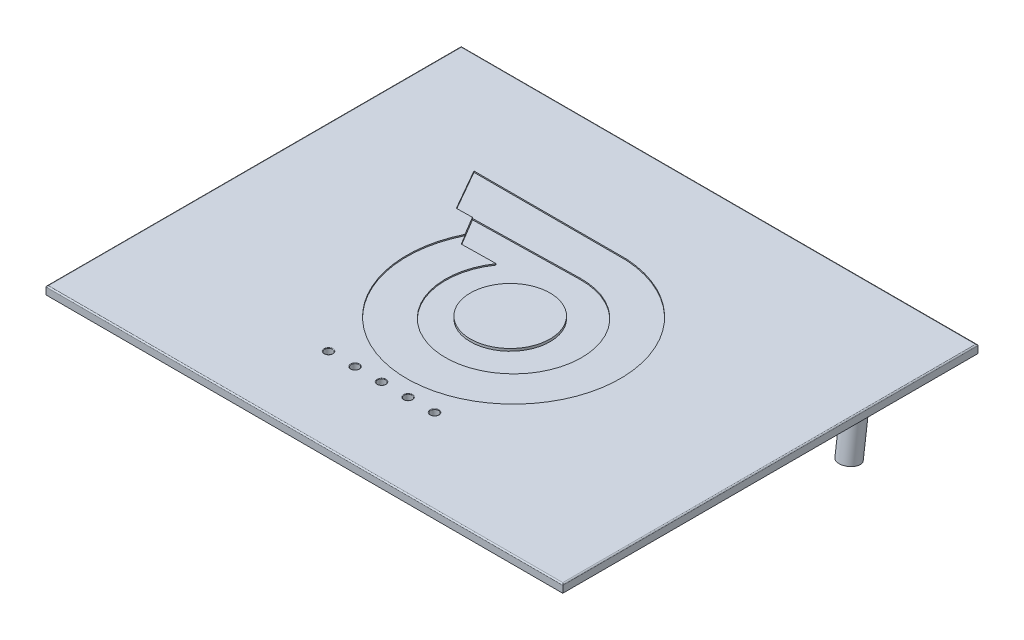
from build123d import *

# Parameters (mm, degrees)
SKETCH1_W                      = 128
SKETCH1_H                      = 101
BOSS_EXTRUDE1_DEPTH            = 2
SKETCH2_W                      = 1.2
SKETCH2_H                      = 98
BOSS_EXTRUDE2_DEPTH            = 1
SKETCH3_W                      = 128
SKETCH3_H                      = 2
BOSS_EXTRUDE3_DEPTH            = 0.48
SKETCH4_W                      = 128
SKETCH4_H                      = 2
BOSS_EXTRUDE4_DEPTH            = 1.37
BOSS_EXTRUDE5_START            = 2
SKETCH5_R                      = 2.5
BOSS_EXTRUDE5_DEPTH            = 13
M3_CLEARANCE_HOLE1_D           = 2.6
M3_CLEARANCE_HOLE1_DEPTH       = 10
M3_CLEARANCE_HOLE1_CSINK_D     = 3
M3_CLEARANCE_HOLE1_CSINK_ANGLE = 90
M3_CLEARANCE_HOLE1_TIP         = 0.781118805
M3_CLEARANCE_HOLE2_D           = 2.6
M3_CLEARANCE_HOLE2_DEPTH       = 10
M3_CLEARANCE_HOLE2_CSINK_D     = 3
M3_CLEARANCE_HOLE2_CSINK_ANGLE = 90
M3_CLEARANCE_HOLE2_TIP         = 0.781118805
SKETCH14_R                     = 1
CUT_EXTRUDE1_DEPTH             = 5
CUT_EXTRUDE2_DEPTH             = 0.4
CUT_EXTRUDE4_DEPTH             = 0.3
CUT_EXTRUDE5_DEPTH             = 0.6
SKETCH30_R                     = 9.871633986
BOSS_EXTRUDE13_DEPTH           = 0.6
FILLET1_R                      = 0.3
FILLET2_R                      = 0.12


with BuildPart() as part:
    # Sketch1 → Boss-Extrude1 (new body)
    with BuildSketch(Plane(origin=(0, 0, 0), x_dir=(1, 0, 0), z_dir=(0, 1, 0))):
        Rectangle(SKETCH1_W, SKETCH1_H)
    extrude(amount=BOSS_EXTRUDE1_DEPTH)

    # Sketch2 → Boss-Extrude2 (add)
    with BuildSketch(Plane.XZ):
        with Locations((62.3, 0)):
            Rectangle(SKETCH2_W, SKETCH2_H)
        with Locations((-62.3, 0)):
            Rectangle(SKETCH2_W, SKETCH2_H)
    extrude(amount=BOSS_EXTRUDE2_DEPTH)

    # Sketch3 → Boss-Extrude3 (add)
    with BuildSketch(Plane.XY.offset(50.5)):
        with Locations((0, 1)):
            Rectangle(SKETCH3_W, SKETCH3_H)
    extrude(amount=BOSS_EXTRUDE3_DEPTH)

    # Sketch4 → Boss-Extrude4 (add)
    with BuildSketch(Plane(origin=(0, 0, -50.5), x_dir=(-1, 0, 0), z_dir=(0, 0, -1))):
        with Locations((0, 1)):
            Rectangle(SKETCH4_W, SKETCH4_H)
    extrude(amount=BOSS_EXTRUDE4_DEPTH)

    # Sketch5 → Boss-Extrude5 (add)
    with BuildSketch(Plane(origin=(0, -10.49000593, 1.363700771), x_dir=(1, 0, 0), z_dir=(0, 0.9916556173432378, -0.12891523025462098)).offset(BOSS_EXTRUDE5_START)):
        with Locations((-59.478852689, 26.433660117)):
            Circle(SKETCH5_R)
        with Locations((58.821147316, 26.433660117)):
            Circle(SKETCH5_R)
    extrude(amount=BOSS_EXTRUDE5_DEPTH)

    # M3 Clearance Hole1
    with Locations(Plane(origin=(0, -8.506694695, 1.10587031), x_dir=(1, 0, 0), z_dir=(0, -0.9916556173432378, 0.12891523025462098))):
        with Locations((58.821147316, -26.433660117)):
            CounterSinkHole(M3_CLEARANCE_HOLE1_D / 2, M3_CLEARANCE_HOLE1_CSINK_D / 2, depth=M3_CLEARANCE_HOLE1_DEPTH, counter_sink_angle=M3_CLEARANCE_HOLE1_CSINK_ANGLE)
            with Locations((0, 0, -(M3_CLEARANCE_HOLE1_DEPTH + M3_CLEARANCE_HOLE1_TIP / 2))):  # 118° drill point
                Cone(0, M3_CLEARANCE_HOLE1_D / 2, M3_CLEARANCE_HOLE1_TIP, mode=Mode.SUBTRACT)

    # M3 Clearance Hole2
    with Locations(Plane(origin=(0, -8.506694695, 1.10587031), x_dir=(1, 0, 0), z_dir=(0, -0.9916556173432378, 0.12891523025462098))):
        with Locations((-59.478852689, -26.433660117)):
            CounterSinkHole(M3_CLEARANCE_HOLE2_D / 2, M3_CLEARANCE_HOLE2_CSINK_D / 2, depth=M3_CLEARANCE_HOLE2_DEPTH, counter_sink_angle=M3_CLEARANCE_HOLE2_CSINK_ANGLE)
            with Locations((0, 0, -(M3_CLEARANCE_HOLE2_DEPTH + M3_CLEARANCE_HOLE2_TIP / 2))):  # 118° drill point
                Cone(0, M3_CLEARANCE_HOLE2_D / 2, M3_CLEARANCE_HOLE2_TIP, mode=Mode.SUBTRACT)

    # Sketch14 → Cut-Extrude1 (cut)
    with BuildSketch(Plane.XZ):
        with Locations((-8.372305841, 30.05428165)):
            Circle(SKETCH14_R)
        with Locations((4.754600466, 30.05428165)):
            Circle(SKETCH14_R)
        with Locations((11.318053619, 30.05428165)):
            Circle(SKETCH14_R)
        with Locations((-14.935758995, 30.05428165)):
            Circle(SKETCH14_R)
        with Locations((-1.808852688, 30.05428165)):
            Circle(SKETCH14_R)
    extrude(amount=-CUT_EXTRUDE1_DEPTH, mode=Mode.SUBTRACT)

    # Sketch15 → Cut-Extrude2 (cut)
    with BuildSketch(Plane.XZ):
        Polygon((-16.43147406, 32.05428165), (14.761074601, 32.05428165), (19.761074601, 32.05428165), (19.761074601, 28.05428165), (14.761074601, 28.05428165), (-16.43147406, 28.05428165), (-21.43147406, 28.05428165), (-21.43147406, 32.05428165), align=None)
    extrude(amount=-CUT_EXTRUDE2_DEPTH, mode=Mode.SUBTRACT)

    # Sketch31 → Cut-Extrude4 (cut)
    with BuildSketch(Plane(origin=(0, 2, 0), x_dir=(1, 0, 0), z_dir=(0, 1, 0))):
        with BuildLine():
            Line((-35.589637389, 26.611090632), (2.358171766, 26.611090632))
            ThreePointArc((2.358171766, 26.611090632), (11.389438086, -23.958753128), (-20.168517513, 16.574792334))
            Line((-20.168517513, 16.574792334), (-29.764841633, 16.423494794))
            Line((-29.764841633, 16.423494794), (-35.589637389, 26.611090632))
        make_face()
    extrude(amount=-CUT_EXTRUDE4_DEPTH, mode=Mode.SUBTRACT)

    # Sketch29 → Cut-Extrude5 (cut)
    with BuildSketch(Plane(origin=(0, 2, 0), x_dir=(1, 0, 0), z_dir=(0, 1, 0))):
        with BuildLine():
            Line((-25.889090528, 16.549174918), (0.216418019, 17.068757453))
            ThreePointArc((0.216418019, 17.068757453), (8.636281726, -14.628247298), (-13.255238872, 9.79214461))
            Line((-13.255238872, 9.79214461), (-21.775344713, 9.65781494))
            Line((-21.775344713, 9.65781494), (-25.889090528, 16.549174918))
        make_face()
    extrude(amount=-CUT_EXTRUDE5_DEPTH, mode=Mode.SUBTRACT)

    # Fillet1
    fillet1_edges = [part.edges().sort_by_distance(p)[0] for p in [
        (64, 2, -0.445),
        (0, 2, -51.87),
        (-64, 2, -0.445),
        (0, 2, 50.98),
    ]]
    fillet(fillet1_edges, radius=FILLET1_R)

    # Fillet2
    fillet2_edges = [part.edges().sort_by_distance(p)[0] for p in [
        (10.318053619, 0.4, 30.05428165),
        (10.318053619, 2, 30.05428165),
        (3.754600466, 0.4, 30.05428165),
        (3.754600466, 2, 30.05428165),
        (-2.808852688, 0.4, 30.05428165),
        (-2.808852688, 2, 30.05428165),
        (-9.372305841, 0.4, 30.05428165),
        (-9.372305841, 2, 30.05428165),
        (-15.935758995, 0.4, 30.05428165),
        (-15.935758995, 2, 30.05428165),
    ]]
    fillet(fillet2_edges, radius=FILLET2_R)


with BuildPart() as body_2:
    # Sketch30 → Boss-Extrude13 (new body)
    with BuildSketch(Plane(origin=(0, 2, 0), x_dir=(1, 0, 0), z_dir=(0, 1, 0))):
        Circle(SKETCH30_R)
    extrude(amount=-BOSS_EXTRUDE13_DEPTH)


solid = Compound([part.part, body_2.part])
